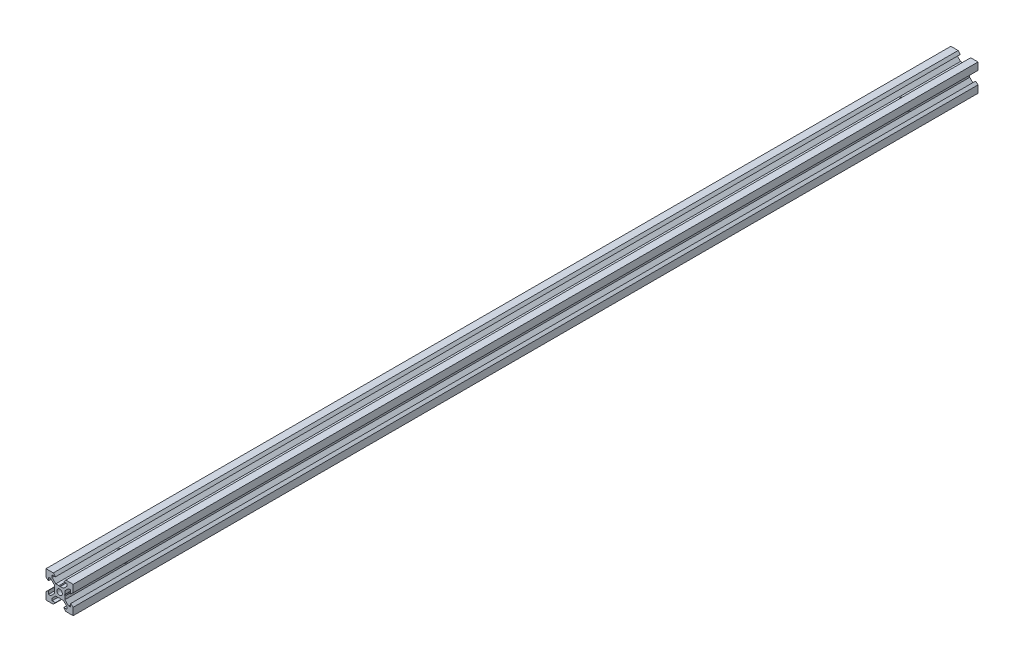
from build123d import *

# Parameters (mm, degrees)
SKETCH1_R               = 2
BOSS_EXTRUDE1_DEPTH     = 666
CUT_EXTRUDE1_DEPTH      = 667.220091261
CUT_EXTRUDE1_DEPTH_BACK = 667.220091261
SKETCH2_R               = 2
CUT_EXTRUDE2_DEPTH      = 667.220091261
CUT_EXTRUDE2_DEPTH_BACK = 667.220091261
SKETCH3_R               = 2


with BuildPart() as part:
    # Sketch1 → Boss-Extrude1 (new body)
    with BuildSketch(Plane.XY):
        Polygon((10, 4.610379336), (10, 10), (4.610379336, 10), (3.1, 8.2), (5.5, 8.2), (5.5, 6.560660172), (2.839339828, 3.9), (0.519615242, 3.9), (0, 3.6), (-0.519615242, 3.9), (-2.839339828, 3.9), (-5.5, 6.560660172), (-5.5, 8.2), (-3.1, 8.2), (-4.610379336, 10), (-10, 10), (-10, 4.610379336), (-8.2, 3.1), (-8.2, 5.5), (-6.560660172, 5.5), (-3.9, 2.839339828), (-3.9, 0.519615242), (-3.6, 0), (-3.9, -0.519615242), (-3.9, -2.839339828), (-6.560660172, -5.5), (-8.2, -5.5), (-8.2, -3.1), (-10, -4.610379336), (-10, -10), (-4.610379336, -10), (-3.1, -8.2), (-5.5, -8.2), (-5.5, -6.560660172), (-2.839339828, -3.9), (-0.519615242, -3.9), (0, -3.6), (0.519615242, -3.9), (2.839339828, -3.9), (5.5, -6.560660172), (5.5, -8.2), (3.1, -8.2), (4.610379336, -10), (10, -10), (10, -4.610379336), (8.2, -3.1), (8.2, -5.5), (6.560660172, -5.5), (3.9, -2.839339828), (3.9, -0.519615242), (3.6, 0), (3.9, 0.519615242), (3.9, 2.839339828), (6.560660172, 5.5), (8.2, 5.5), (8.2, 3.1), align=None)
        Circle(SKETCH1_R, mode=Mode.SUBTRACT)
    extrude(amount=BOSS_EXTRUDE1_DEPTH)

    # Sketch2 → Cut-Extrude1 (cut, two sides: drawn at the far end of the back side and taken through both)
    with BuildSketch(Plane(origin=(0, -3.9, 0), x_dir=(-1, 0, 0), z_dir=(0, -1, 0)).offset(-CUT_EXTRUDE1_DEPTH_BACK)):
        with Locations((0, -621)):
            Circle(SKETCH2_R)
        with Locations((0, -45)):
            Circle(SKETCH2_R)
    extrude(amount=CUT_EXTRUDE1_DEPTH + CUT_EXTRUDE1_DEPTH_BACK, mode=Mode.SUBTRACT)

    # Sketch3 → Cut-Extrude2 (cut, two sides: drawn at the far end of the back side and taken through both)
    with BuildSketch(Plane(origin=(3.9, 0, 0), x_dir=(0, 0, -1), z_dir=(1, 0, 0)).offset(-CUT_EXTRUDE2_DEPTH_BACK)):
        with Locations((-45, 0)):
            Circle(SKETCH3_R)
        with Locations((-621, 0)):
            Circle(SKETCH3_R)
    extrude(amount=CUT_EXTRUDE2_DEPTH + CUT_EXTRUDE2_DEPTH_BACK, mode=Mode.SUBTRACT)


solid = part.part
